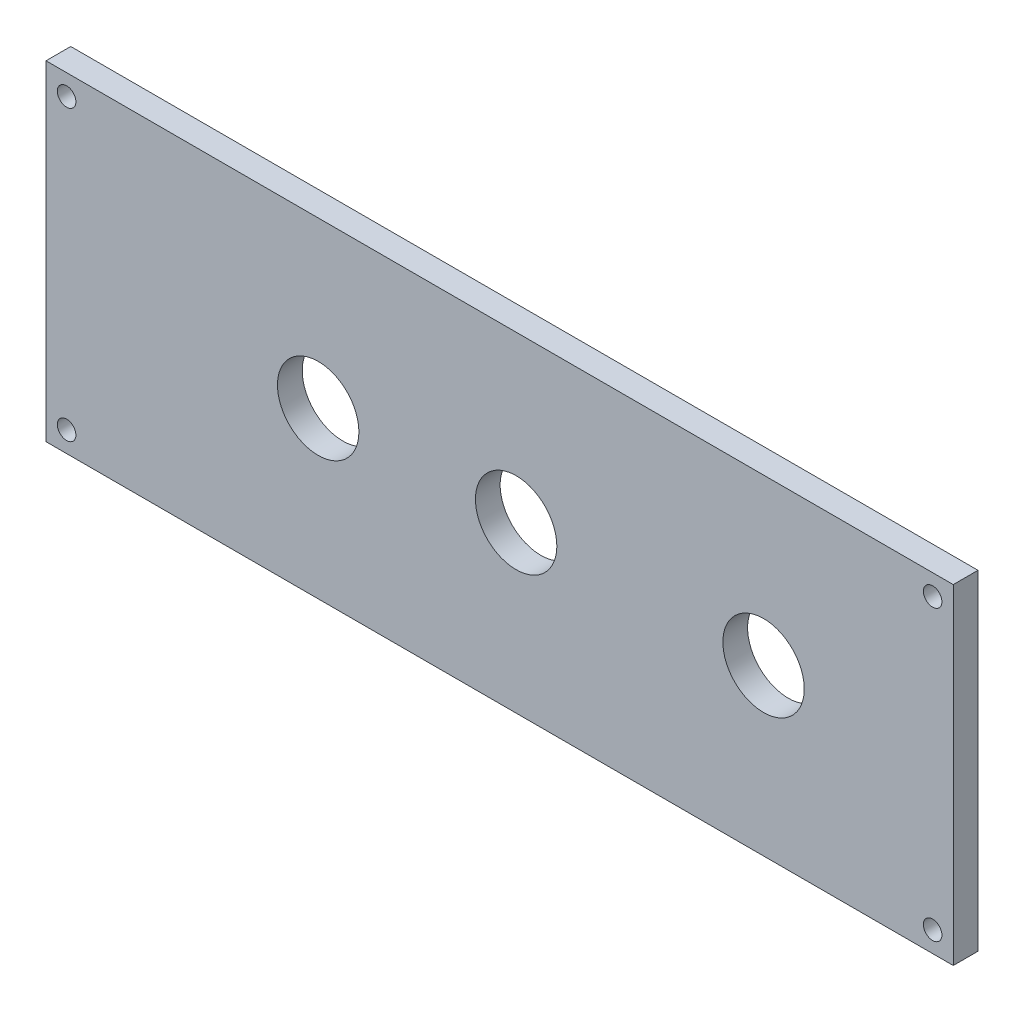
from build123d import *

# Parameters (mm, degrees)
SKETCH1_W           = 110
SKETCH1_H           = 40
BOSS_EXTRUDE1_DEPTH = 3
SKETCH2_R           = 4.9365
SKETCH2_R_2         = 1.125
SKETCH2_R_3         = 4.935
CUT_EXTRUDE1_DEPTH  = 118.08543889


with BuildPart() as part:
    # Sketch1 → Boss-Extrude1 (new body)
    with BuildSketch(Plane.XY):
        with Locations((55, 20)):
            Rectangle(SKETCH1_W, SKETCH1_H)
    extrude(amount=BOSS_EXTRUDE1_DEPTH)

    # Sketch2 → Cut-Extrude1 (cut, through all)
    with BuildSketch(Plane.XY.offset(3)):
        with Locations((33, 20)):
            Circle(SKETCH2_R)
        with Locations((57, 20)):
            Circle(SKETCH2_R)
        with Locations((2.5, 37.5)):
            Circle(SKETCH2_R_2)
        with Locations((107.5, 37.5)):
            Circle(SKETCH2_R_2)
        with Locations((107.5, 2.5)):
            Circle(SKETCH2_R_2)
        with Locations((2.5, 2.5)):
            Circle(SKETCH2_R_2)
        with Locations((87, 20)):
            Circle(SKETCH2_R_3)
    extrude(amount=-CUT_EXTRUDE1_DEPTH, mode=Mode.SUBTRACT)


solid = part.part
